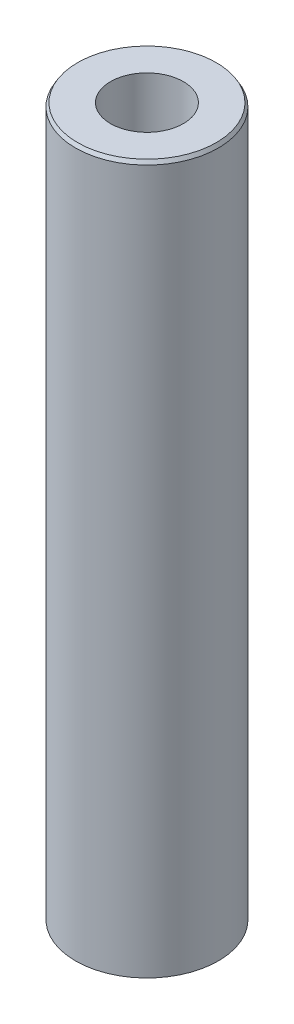
from build123d import *
from OCP.BRepFilletAPI import BRepFilletAPI_MakeChamfer

# Parameters (mm, degrees)
SKETCH1_R           = 47.5
BOSS_EXTRUDE1_DEPTH = 471.975598879
SKETCH2_R           = 24.229490295
CUT_EXTRUDE1_DEPTH  = 477.73206934
CHAMFER1_SIZE       = 2.412382085
CHAMFER1_SIZE2      = 1.392789446


with BuildPart() as part:
    # Sketch1 → Boss-Extrude1 (new body)
    with BuildSketch(Plane(origin=(0, 0, 0), x_dir=(1, 0, 0), z_dir=(0, 1, 0))):
        Circle(SKETCH1_R)
    extrude(amount=BOSS_EXTRUDE1_DEPTH)

    # Sketch2 → Cut-Extrude1 (cut, through all)
    with BuildSketch(Plane(origin=(0, 0, 0), x_dir=(1, 0, 0), z_dir=(0, 1, 0))):
        Circle(SKETCH2_R)
    extrude(amount=CUT_EXTRUDE1_DEPTH, mode=Mode.SUBTRACT)

    # Chamfer1: one chamfer whose edges measure the first distance from different faces: ONE call of the kernel's chamfer builder (chamfer() names one face for all edges)
    chamfer1_edges_1 = [part.edges().sort_by_distance(p)[0] for p in [
        (-47.5, 471.975598879, 0),
    ]]
    chamfer1_side_1 = [part.faces().sort_by_distance(p)[0] for p in [
        (-47.5, 235.987799439, 0),
    ]]
    chamfer1_edges_2 = [part.edges().sort_by_distance(p)[0] for p in [
        (-47.5, 0, 0),
    ]]
    chamfer1_side_2 = [part.faces().sort_by_distance(p)[0] for p in [
        (-46.156497116, 0, 0),
    ]]
    chamfer1 = BRepFilletAPI_MakeChamfer(part.part.solid().wrapped)
    for e in chamfer1_edges_1:
        chamfer1.Add(CHAMFER1_SIZE, CHAMFER1_SIZE2, e.wrapped, chamfer1_side_1[0].wrapped)  # the first distance lies on this face
    for e in chamfer1_edges_2:
        chamfer1.Add(CHAMFER1_SIZE, CHAMFER1_SIZE2, e.wrapped, chamfer1_side_2[0].wrapped)  # the first distance lies on this face
    add(Compound.cast(chamfer1.Shape()), mode=Mode.REPLACE)


solid = part.part
